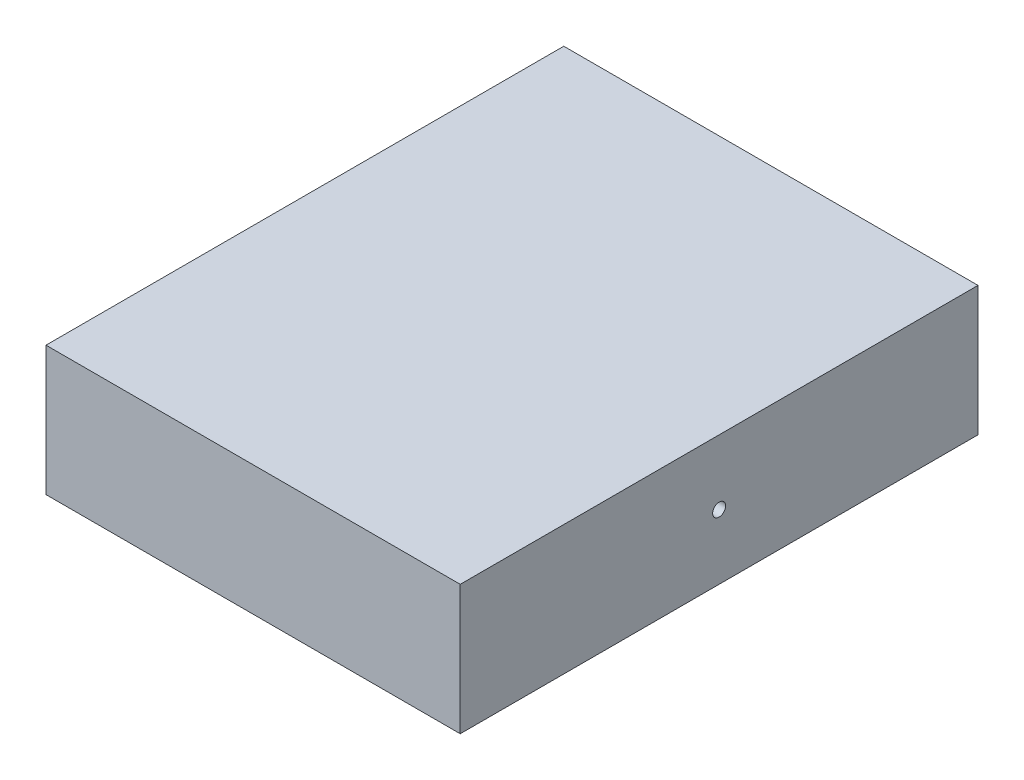
from build123d import *

# Parameters (mm, degrees)
SKETCH1_W           = 406.4
SKETCH1_H           = 127
BOSS_EXTRUDE1_DEPTH = 508
SKETCH2_R           = 6.35
CUT_EXTRUDE1_DEPTH  = 663.837808216


with BuildPart() as part:
    # Sketch1 → Boss-Extrude1 (new body)
    with BuildSketch(Plane.XY):
        with Locations((203.2, 63.5)):
            Rectangle(SKETCH1_W, SKETCH1_H)
    extrude(amount=BOSS_EXTRUDE1_DEPTH)

    # Sketch2 → Cut-Extrude1 (cut, through all)
    with BuildSketch(Plane(origin=(406.4, 0, 0), x_dir=(0, 0, -1), z_dir=(1, 0, 0))):
        with Locations((-254, 63.5)):
            Circle(SKETCH2_R)
    extrude(amount=-CUT_EXTRUDE1_DEPTH, mode=Mode.SUBTRACT)


solid = part.part
